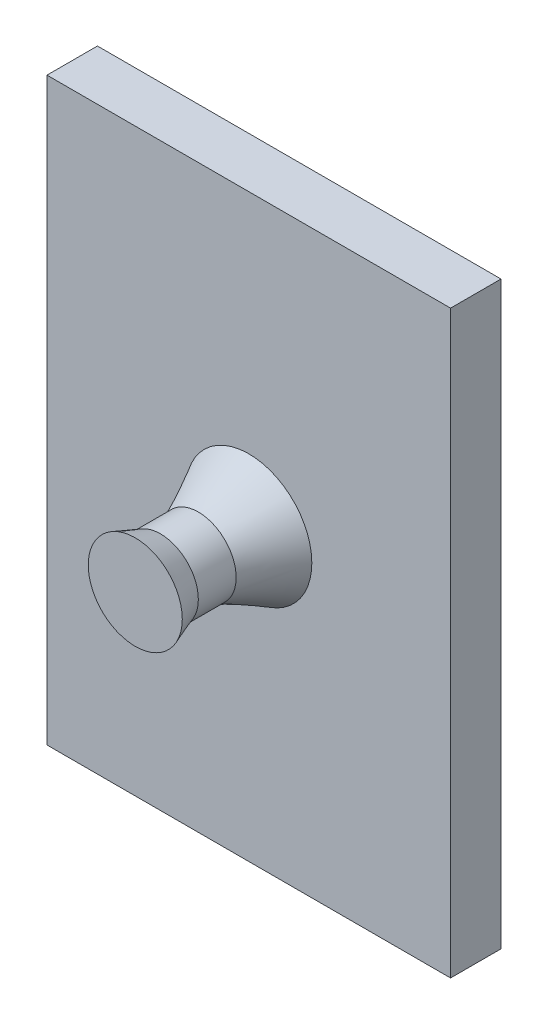
from build123d import *

# Parameters (mm, degrees)
SKETCH1_W           = 16
SKETCH1_H           = 23
BOSS_EXTRUDE1_DEPTH = 2
SKETCH6_R           = 1.5
BOSS_EXTRUDE3_DEPTH = 1.5
SKETCH7_R           = 1.5
BOSS_EXTRUDE4_DEPTH = 1
BOSS_EXTRUDE4_DRAFT = -20


with BuildPart() as part:
    # Sketch1 → Boss-Extrude1 (new body)
    with BuildSketch(Plane.XY):
        with Locations((8, 11.5)):
            Rectangle(SKETCH1_W, SKETCH1_H)
    extrude(amount=BOSS_EXTRUDE1_DEPTH)

    # Loft1: read off the stored shape, not the designer's step
    # Loft1: loft between two sections, ruled curve by curve
    loft1_from = [
        Edge.make_bspline([(10.5, 11.5, 2), (10.5, 16.5, 2), (5.5, 16.5, 2), (5.5, 11.5, 2), (5.5, 6.5, 2), (10.5, 6.5, 2), (10.5, 11.5, 2)], [0, 0, 0, 0, 0.5, 0.5, 0.5, 1, 1, 1, 1], 3, [1, 0.333333333, 0.333333333, 1, 0.333333333, 0.333333333, 1]),
    ]
    loft1_to = [
        Edge.make_bspline([(9.382185261, 10.91727888, 4), (10.547627501, 13.681649403, 4), (7.783256979, 14.847091642, 4), (6.617814739, 12.08272112, 4), (5.452372499, 9.318350597, 4), (8.216743021, 8.152908358, 4), (9.382185261, 10.91727888, 4)], [0, 0, 0, 0, 0.5, 0.5, 0.5, 1, 1, 1, 1], 3, [1, 0.333333333, 0.333333333, 1, 0.333333333, 0.333333333, 1]),
    ]
    loft1 = Solid(Shell([*[Face.make_surface_from_curves(loft1_from[k], loft1_to[k]) for k in range(1)], Face(Wire(loft1_from)), Face(Wire(loft1_to))]))
    add(loft1)

    # Sketch6 → Boss-Extrude3 (add)
    with BuildSketch(Plane.XY.offset(4)):
        with Locations(Location((8, 11.5, 0), (0, 0, 337.14))):
            Circle(SKETCH6_R)
    extrude(amount=BOSS_EXTRUDE3_DEPTH)


with BuildPart() as boss_extrude4_tool:
    # Sketch7 → Boss-Extrude4 (with draft: the straight prism first)
    with BuildSketch(Plane.XY.offset(5.5)):
        with Locations(Location((8, 11.5, 0), (0, 0, 337.14))):
            Circle(SKETCH7_R)
    extrude(amount=BOSS_EXTRUDE4_DEPTH)
    # Boss-Extrude4: the draft: its side faces are tilted about the plane it starts from
    boss_extrude4_sides = [boss_extrude4_tool.faces().sort_by_distance(p)[0] for p in [
        (6.617814739, 12.08272112, 6),
    ]]
    draft(boss_extrude4_sides, Plane.XY.offset(5.5), BOSS_EXTRUDE4_DRAFT)


with BuildPart() as part_1:
    add(part.part)

    # Boss-Extrude4: add boss_extrude4_tool
    add(boss_extrude4_tool.part)


solid = part_1.part
